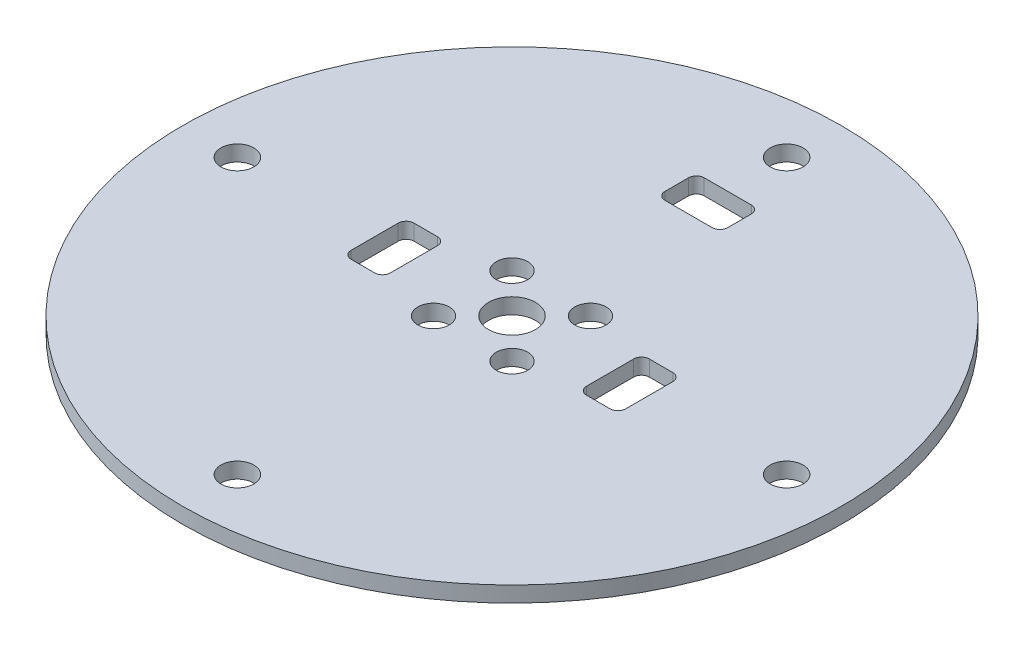
from build123d import *

# Parameters (mm, degrees)
SKETCH_1_R             = 42
SM_BASE_FLANGE_1_DEPTH = 2
CUT_EXTRUDE_1_REACH    = 61.431
SKETCH_6_R             = 2.1
SKETCH_6_R_2           = 3
SKETCH_6_R_3           = 2
SKETCH_6_W             = 8
SKETCH_6_H             = 5
SKETCH_6_W_2           = 5
SKETCH_6_H_2           = 8
FILLET_1_R             = 1


# Sheet-metal steps are written as plain solids
with BuildPart() as part:
    # Sketch 1 → 基体-法兰1 (new body)
    with BuildSketch(Plane(origin=(0, 0, 0), x_dir=(1, 0, 0), z_dir=(0, 1, 0))):
        with Locations(Location((0, 0, 0), (0, 0, 270))):
            Circle(SKETCH_1_R)
    extrude(amount=-SM_BASE_FLANGE_1_DEPTH)

    # 草图6 → 切除-拉伸1 (cut, up to next)
    with BuildSketch(Plane(origin=(0, 0, 0), x_dir=(1, 0, 0), z_dir=(0, 1, 0)), mode=Mode.PRIVATE) as cut_extrude_1_sk1:
        with Locations(Location((0, 35, 0), (0, 0, 270))):
            Circle(SKETCH_6_R)
    cut_extrude_1_tool1 = extrude(cut_extrude_1_sk1.sketch, amount=-CUT_EXTRUDE_1_REACH, mode=Mode.PRIVATE) & part.part
    # 草图6 → 切除-拉伸1 (cut, up to next)
    with BuildSketch(Plane(origin=(0, 0, 0), x_dir=(1, 0, 0), z_dir=(0, 1, 0)), mode=Mode.PRIVATE) as cut_extrude_1_sk2:
        with Locations(Location((35, 0, 0), (0, 0, 270))):
            Circle(SKETCH_6_R)
    cut_extrude_1_tool2 = extrude(cut_extrude_1_sk2.sketch, amount=-CUT_EXTRUDE_1_REACH, mode=Mode.PRIVATE) & part.part
    # 草图6 → 切除-拉伸1 (cut, up to next)
    with BuildSketch(Plane(origin=(0, 0, 0), x_dir=(1, 0, 0), z_dir=(0, 1, 0)), mode=Mode.PRIVATE) as cut_extrude_1_sk3:
        with Locations(Location((0, -35, 0), (0, 0, 270))):
            Circle(SKETCH_6_R)
    cut_extrude_1_tool3 = extrude(cut_extrude_1_sk3.sketch, amount=-CUT_EXTRUDE_1_REACH, mode=Mode.PRIVATE) & part.part
    # 草图6 → 切除-拉伸1 (cut, up to next)
    with BuildSketch(Plane(origin=(0, 0, 0), x_dir=(1, 0, 0), z_dir=(0, 1, 0)), mode=Mode.PRIVATE) as cut_extrude_1_sk4:
        with Locations(Location((-35, 0, 0), (0, 0, 270))):
            Circle(SKETCH_6_R)
    cut_extrude_1_tool4 = extrude(cut_extrude_1_sk4.sketch, amount=-CUT_EXTRUDE_1_REACH, mode=Mode.PRIVATE) & part.part
    # 草图6 → 切除-拉伸1 (cut, up to next)
    with BuildSketch(Plane(origin=(0, 0, 0), x_dir=(1, 0, 0), z_dir=(0, 1, 0)), mode=Mode.PRIVATE) as cut_extrude_1_sk5:
        with Locations(Location((0, 0, 0), (0, 0, 270))):
            Circle(SKETCH_6_R_2)
    cut_extrude_1_tool5 = extrude(cut_extrude_1_sk5.sketch, amount=-CUT_EXTRUDE_1_REACH, mode=Mode.PRIVATE) & part.part
    # 草图6 → 切除-拉伸1 (cut, up to next)
    with BuildSketch(Plane(origin=(0, 0, 0), x_dir=(1, 0, 0), z_dir=(0, 1, 0)), mode=Mode.PRIVATE) as cut_extrude_1_sk6:
        with Locations(Location((-5, 5, 0), (0, 0, 270))):
            Circle(SKETCH_6_R_3)
    cut_extrude_1_tool6 = extrude(cut_extrude_1_sk6.sketch, amount=-CUT_EXTRUDE_1_REACH, mode=Mode.PRIVATE) & part.part
    # 草图6 → 切除-拉伸1 (cut, up to next)
    with BuildSketch(Plane(origin=(0, 0, 0), x_dir=(1, 0, 0), z_dir=(0, 1, 0)), mode=Mode.PRIVATE) as cut_extrude_1_sk7:
        with Locations(Location((5, 5, 0), (0, 0, 270))):
            Circle(SKETCH_6_R_3)
    cut_extrude_1_tool7 = extrude(cut_extrude_1_sk7.sketch, amount=-CUT_EXTRUDE_1_REACH, mode=Mode.PRIVATE) & part.part
    # 草图6 → 切除-拉伸1 (cut, up to next)
    with BuildSketch(Plane(origin=(0, 0, 0), x_dir=(1, 0, 0), z_dir=(0, 1, 0)), mode=Mode.PRIVATE) as cut_extrude_1_sk8:
        with Locations(Location((5, -5, 0), (0, 0, 270))):
            Circle(SKETCH_6_R_3)
    cut_extrude_1_tool8 = extrude(cut_extrude_1_sk8.sketch, amount=-CUT_EXTRUDE_1_REACH, mode=Mode.PRIVATE) & part.part
    # 草图6 → 切除-拉伸1 (cut, up to next)
    with BuildSketch(Plane(origin=(0, 0, 0), x_dir=(1, 0, 0), z_dir=(0, 1, 0)), mode=Mode.PRIVATE) as cut_extrude_1_sk9:
        with Locations(Location((-5, -5, 0), (0, 0, 270))):
            Circle(SKETCH_6_R_3)
    cut_extrude_1_tool9 = extrude(cut_extrude_1_sk9.sketch, amount=-CUT_EXTRUDE_1_REACH, mode=Mode.PRIVATE) & part.part
    # 草图6 → 切除-拉伸1 (cut, up to next)
    with BuildSketch(Plane(origin=(0, 0, 0), x_dir=(1, 0, 0), z_dir=(0, 1, 0)), mode=Mode.PRIVATE) as cut_extrude_1_sk10:
        with Locations((0, 25)):
            Rectangle(SKETCH_6_W, SKETCH_6_H)
    cut_extrude_1_tool10 = extrude(cut_extrude_1_sk10.sketch, amount=-CUT_EXTRUDE_1_REACH, mode=Mode.PRIVATE) & part.part
    # 草图6 → 切除-拉伸1 (cut, up to next)
    with BuildSketch(Plane(origin=(0, 0, 0), x_dir=(1, 0, 0), z_dir=(0, 1, 0)), mode=Mode.PRIVATE) as cut_extrude_1_sk11:
        with Locations((15, 0)):
            Rectangle(SKETCH_6_W_2, SKETCH_6_H_2)
    cut_extrude_1_tool11 = extrude(cut_extrude_1_sk11.sketch, amount=-CUT_EXTRUDE_1_REACH, mode=Mode.PRIVATE) & part.part
    # 草图6 → 切除-拉伸1 (cut, up to next)
    with BuildSketch(Plane(origin=(0, 0, 0), x_dir=(1, 0, 0), z_dir=(0, 1, 0)), mode=Mode.PRIVATE) as cut_extrude_1_sk12:
        with Locations((-15, 0)):
            Rectangle(SKETCH_6_W_2, SKETCH_6_H_2)
    cut_extrude_1_tool12 = extrude(cut_extrude_1_sk12.sketch, amount=-CUT_EXTRUDE_1_REACH, mode=Mode.PRIVATE) & part.part
    add(cut_extrude_1_tool1.solids().sort_by_distance((0, 0, -35))[0], mode=Mode.SUBTRACT)
    add(cut_extrude_1_tool2.solids().sort_by_distance((35, 0, 0))[0], mode=Mode.SUBTRACT)
    add(cut_extrude_1_tool3.solids().sort_by_distance((0, 0, 35))[0], mode=Mode.SUBTRACT)
    add(cut_extrude_1_tool4.solids().sort_by_distance((-35, 0, 0))[0], mode=Mode.SUBTRACT)
    add(cut_extrude_1_tool5.solids().sort_by_distance((0, 0, 0))[0], mode=Mode.SUBTRACT)
    add(cut_extrude_1_tool6.solids().sort_by_distance((-5, 0, -5))[0], mode=Mode.SUBTRACT)
    add(cut_extrude_1_tool7.solids().sort_by_distance((5, 0, -5))[0], mode=Mode.SUBTRACT)
    add(cut_extrude_1_tool8.solids().sort_by_distance((5, 0, 5))[0], mode=Mode.SUBTRACT)
    add(cut_extrude_1_tool9.solids().sort_by_distance((-5, 0, 5))[0], mode=Mode.SUBTRACT)
    add(cut_extrude_1_tool10.solids().sort_by_distance((0, 0, -25))[0], mode=Mode.SUBTRACT)
    add(cut_extrude_1_tool11.solids().sort_by_distance((15, 0, 0))[0], mode=Mode.SUBTRACT)
    add(cut_extrude_1_tool12.solids().sort_by_distance((-15, 0, 0))[0], mode=Mode.SUBTRACT)

    # 圆角1
    fillet_1_edges = [part.edges().sort_by_distance(p)[0] for p in [
        (17.5, -1, -4),
        (17.5, -1, 4),
        (12.5, -1, 4),
        (12.5, -1, -4),
        (-12.5, -1, -4),
        (-12.5, -1, 4),
        (-17.5, -1, 4),
        (-17.5, -1, -4),
        (-4, -1, -22.5),
        (-4, -1, -27.5),
        (4, -1, -27.5),
        (4, -1, -22.5),
    ]]
    fillet(fillet_1_edges, radius=FILLET_1_R)


solid = part.part
